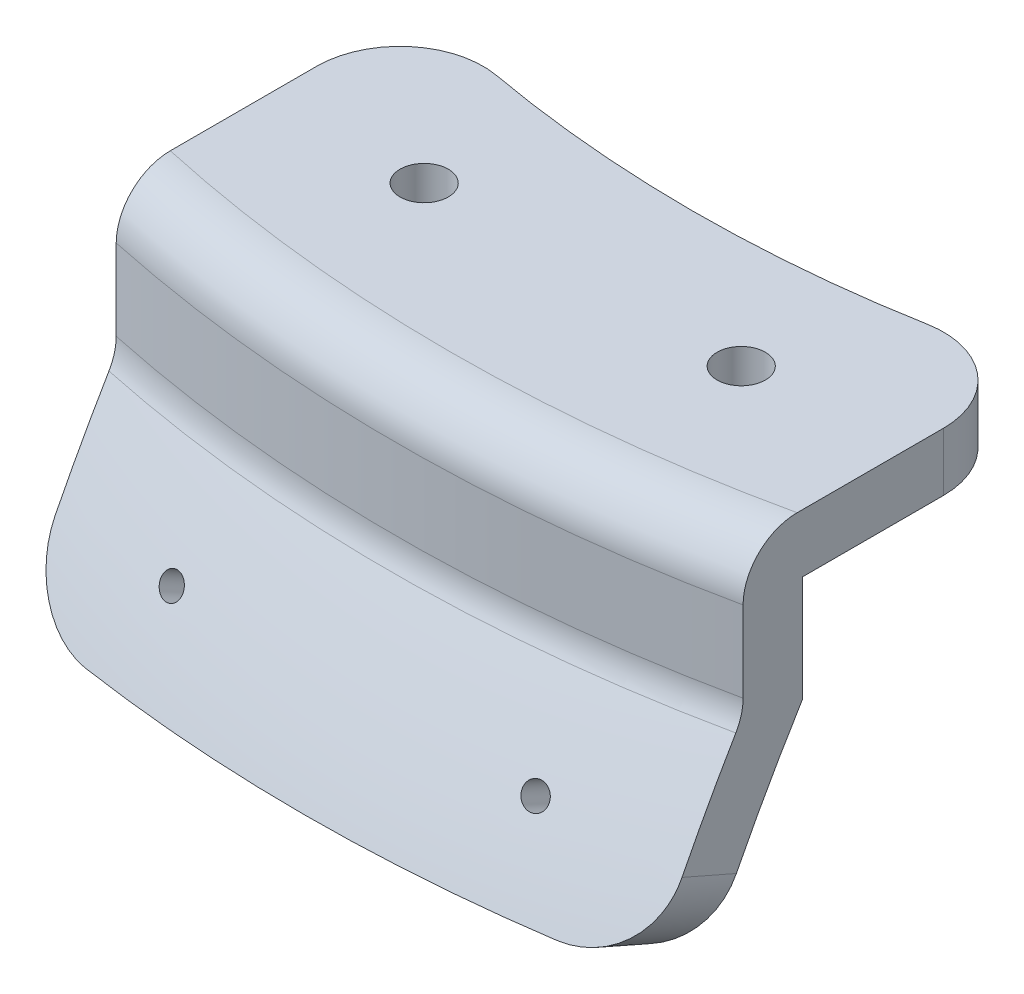
from build123d import *

# Parameters (mm, degrees)
REVOLVE1_ANGLE      = 30
FILLET1_R           = 6.35
SKETCH3_R           = 2.9
CUT_EXTRUDE1_DEPTH  = 204.02156921
SKETCH4_OUTSIDE_W   = 125.474
SKETCH4_OUTSIDE_H   = 77.633
SKETCH4_OUTSIDE_W_2 = 75.329921726
SKETCH4_OUTSIDE_H_2 = 51.667493695
CUT_EXTRUDE2_DEPTH  = 204.02156921
FILLET2_R           = 10


with BuildPart() as part:
    # Sketch2 → Revolve1 (revolve, symmetric)
    with BuildSketch(Plane(origin=(0, 0, 0), x_dir=(0, 0, -1), z_dir=(1, 0, 0))) as revolve1_sk:
        with BuildLine():
            Line((-174.101233777, 207.368503093), (-174.101233777, 194.668503093))
            ThreePointArc((-174.101233777, 194.668503093), (-180.321192386, 183.560119355), (-185.833303485, 172.084026572))
            Line((-185.833303485, 172.084026572), (-192.235041302, 174.91559026))
            ThreePointArc((-192.235041302, 174.91559026), (-186.982593651, 185.916677967), (-181.101233777, 196.594774384))
            Line((-181.101233777, 196.594774384), (-181.101233777, 214.368503093))
            Line((-181.101233777, 214.368503093), (-145.526233777, 214.368503093))
            Line((-145.526233777, 214.368503093), (-145.526233777, 207.368503093))
            Line((-145.526233777, 207.368503093), (-174.101233777, 207.368503093))
        make_face()
    revolve(axis=Axis((0, 89.887777778, 0), (0, 1, 0)), revolution_arc=REVOLVE1_ANGLE / 2)
    revolve(revolve1_sk.sketch, axis=Axis((0, 89.887777778, 0), (0, -1, 0)), revolution_arc=REVOLVE1_ANGLE / 2)

    # Fillet1
    fillet1_edges = [part.edges().sort_by_distance(p)[0] for p in [
        (0, 196.594774384, 181.101233777),
        (0, 214.368503093, 181.101233777),
    ]]
    fillet(fillet1_edges, radius=FILLET1_R)

    # Sketch3 → Cut-Extrude1 (cut, through all)
    with BuildSketch(Plane.XZ.offset(-214.368503093)):
        with Locations((19.05, 158.75)):
            Circle(SKETCH3_R)
        with Locations((-19.05, 158.75)):
            Circle(SKETCH3_R)
    extrude(amount=CUT_EXTRUDE1_DEPTH, mode=Mode.SUBTRACT)

    # Sketch4 outside → Cut-Extrude2 (cut, through all)
    with BuildSketch(Plane(origin=(0, 214.368503093, 0), x_dir=(1, 0, 0), z_dir=(0, 1, 0))):
        with Locations((0, -166.4015)):
            Rectangle(SKETCH4_OUTSIDE_W, SKETCH4_OUTSIDE_H)
        with Locations((0, -166.401294455)):
            Rectangle(SKETCH4_OUTSIDE_W_2, SKETCH4_OUTSIDE_H_2, mode=Mode.SUBTRACT)
    extrude(amount=-CUT_EXTRUDE2_DEPTH, mode=Mode.SUBTRACT)

    # Fillet2
    fillet2_edges = [part.edges().sort_by_distance(p)[0] for p in [
        (-37.664960863, 173.499391116, 185.242847006),
        (-37.664960863, 210.868503093, 140.567547607),
        (37.664960863, 210.868503093, 140.567547607),
        (37.664960863, 173.499391116, 185.242847006),
    ]]
    fillet(fillet2_edges, radius=FILLET2_R)

    # Sketch6 → Cut-Revolve1 (revolve, cut)
    with BuildSketch(Plane(origin=(0, 71.361243959, -36.360369904), x_dir=(0, 0.4539904997395445, 0.8910065241883691), z_dir=(0, 0.891006524188369, -0.4539904997395444))):
        Polygon((216.935007034, 18.979353837), (275.794196508, 24.128865661), (275.663462894, 25.623157708), (216.804273419, 20.473645884), align=None)
    cut_revolve1 = revolve(axis=Axis((18.979353837, 169.847676213, 156.930136687), (0.08715574274765782, 0.45226292882455615, 0.887615975361608)), mode=Mode.SUBTRACT)

    # Mirror1: Cut-Revolve1 across plane
    add(cut_revolve1.mirror(Plane(origin=(0, 0, 0), x_dir=(0, 0, 1), z_dir=(1, 0, 0))), mode=Mode.SUBTRACT)


solid = part.part
